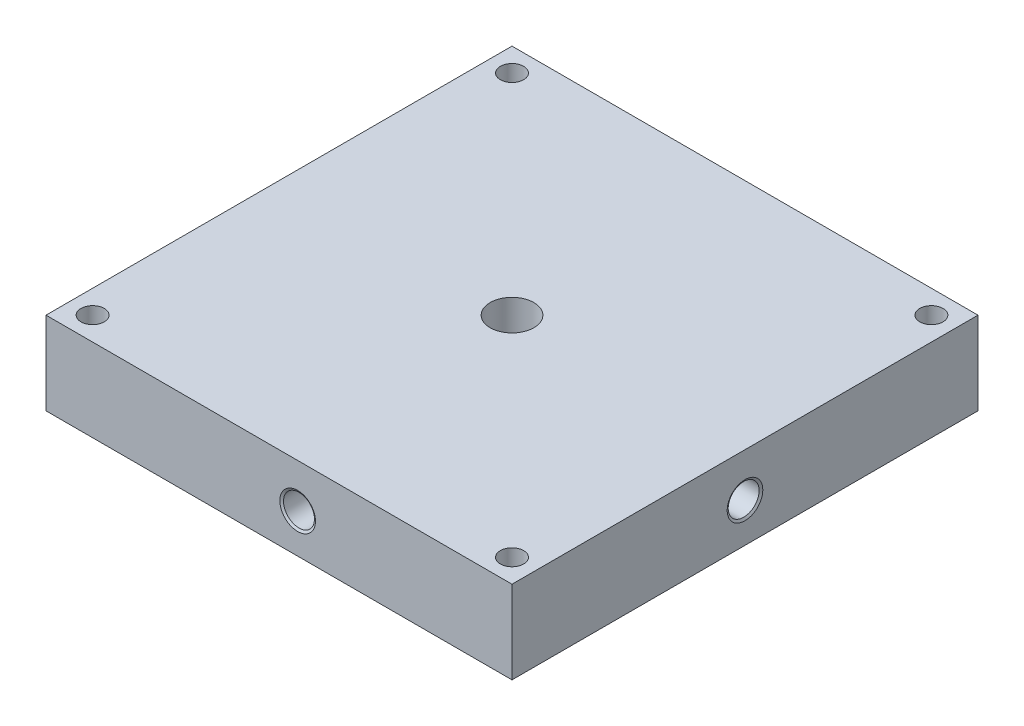
from build123d import *

# Parameters (mm, degrees)
SKETCH5_W                = 127
SKETCH5_H                = 127
SKETCH5_R                = 38.1
SKETCH5_R_2              = 3.175
BOSS_EXTRUDE2_DEPTH      = 17.50822
CUT_EXTRUDE5_REACH       = 145.066
SKETCH8_R                = 3.175
CUT_EXTRUDE9_REACH       = 169.597
SKETCH10_R               = 0.79375
SKETCH11_W               = 127
SKETCH11_H               = 127
SKETCH11_R               = 47.625
BOSS_EXTRUDE3_DEPTH      = 5.08
SKETCH12_R               = 26.9875
SKETCH12_R_2             = 23.8125
CUT_EXTRUDE10_DEPTH      = 2.159
CUT_EXTRUDE12_DEPTH      = 128.262249687
CUT_EXTRUDE12_DEPTH_BACK = 128.262249687
SKETCH14_R               = 3.175
SKETCH15_R               = 19.05
CUT_EXTRUDE13_DEPTH      = 2.032
CIRPATTERN1_COUNT        = 9
CHAMFER1_SIZE            = 0.508


# Read off the part's stored shape, not the designer's step: Q (0.332) Diameter Hole1
with BuildPart() as part:
    # Sketch1 → Revolve1 (revolve)
    with BuildSketch(Plane.XY, mode=Mode.PRIVATE) as revolve1_sk:
        with BuildLine():
            Line((-38.49624, 17.50822), (0, 17.50822))
            Line((0, 17.50822), (0, 0))
            Line((0, 0), (-33.4645, 0))
            Line((-33.4645, 0), (-33.4645, 3.456354569))
            ThreePointArc((-33.4645, 3.456354569), (-33.872854569, 4.980354569), (-34.9885, 6.096))
            Line((-34.9885, 6.096), (-38.49624, 8.96874))
            Line((-38.49624, 8.96874), (-38.49624, 17.50822))
        make_face()
    revolve(revolve1_sk.sketch.rotate(Axis((-44.45, 101.60464546, 0), (0, 1, 0)), 90), axis=Axis((-44.45, 101.60464546, 0), (0, 1, 0)))

    # Sketch5 → Boss-Extrude2 (add)
    with BuildSketch(Plane.XZ):
        with Locations((-44.45, 0)):
            Rectangle(SKETCH5_W, SKETCH5_H)
        with Locations((-44.45, 0)):
            Circle(SKETCH5_R, mode=Mode.SUBTRACT)
        with Locations(Location((-101.6, 57.15, 0), (0, 0, 270))):
            Circle(SKETCH5_R_2, mode=Mode.SUBTRACT)
        with Locations(Location((12.7, 57.15, 0), (0, 0, 90))):
            Circle(SKETCH5_R_2, mode=Mode.SUBTRACT)
        with Locations(Location((12.7, -57.15, 0), (0, 0, 270))):
            Circle(SKETCH5_R_2, mode=Mode.SUBTRACT)
        with Locations(Location((-101.6, -57.15, 0), (0, 0, 90))):
            Circle(SKETCH5_R_2, mode=Mode.SUBTRACT)
    extrude(amount=-BOSS_EXTRUDE2_DEPTH)

    # Sketch8 → Cut-Extrude5 (cut, up to next)
    with BuildSketch(Plane(origin=(19.05, 0, 0), x_dir=(0, 0, -1), z_dir=(1, 0, 0)), mode=Mode.PRIVATE) as cut_extrude5_sk1:
        with Locations((0, 5.588)):
            Circle(SKETCH8_R)
    cut_extrude5_tool1 = extrude(cut_extrude5_sk1.sketch, amount=-CUT_EXTRUDE5_REACH, mode=Mode.PRIVATE) & part.part
    add(cut_extrude5_tool1.solids().sort_by_distance((19.05, 5.588, 0))[0], mode=Mode.SUBTRACT)

    # Sketch10 → Cut-Extrude9 (cut, up to next)
    with BuildSketch(Plane.XY.offset(63.5), mode=Mode.PRIVATE) as cut_extrude9_sk1:
        with Locations((-39.37, 5.588)):
            Circle(SKETCH10_R)
    cut_extrude9_tool1 = extrude(cut_extrude9_sk1.sketch, amount=-CUT_EXTRUDE9_REACH, mode=Mode.PRIVATE) & part.part
    add(cut_extrude9_tool1.solids().sort_by_distance((-39.37, 5.588, 63.5))[0], mode=Mode.SUBTRACT)

    # Sketch11 → Boss-Extrude3 (add)
    with BuildSketch(Plane.XZ):
        with Locations((-44.45, 0)):
            Rectangle(SKETCH11_W, SKETCH11_H)
        with Locations(Location((-44.45, 0, 0), (0, 0, 270))):
            Circle(SKETCH11_R, mode=Mode.SUBTRACT)
    extrude(amount=BOSS_EXTRUDE3_DEPTH)

    # Sketch12 → Cut-Extrude10 (cut)
    with BuildSketch(Plane.XZ):
        with Locations(Location((-44.45, 0, 0), (0, 0, 270))):
            Circle(SKETCH12_R)
        with Locations(Location((-44.45, 0, 0), (0, 0, 270))):
            Circle(SKETCH12_R_2, mode=Mode.SUBTRACT)
    extrude(amount=-CUT_EXTRUDE10_DEPTH, mode=Mode.SUBTRACT)

    # Sketch14 → Cut-Extrude12 (cut, two sides: drawn at the far end of the back side and taken through both)
    with BuildSketch(Plane(origin=(0, 17.50822, 0), x_dir=(1, 0, 0), z_dir=(0, 1, 0)).offset(-CUT_EXTRUDE12_DEPTH_BACK)):
        with Locations(Location((-101.6, 57.15, 0), (0, 0, 270))):
            Circle(SKETCH14_R)
        with Locations(Location((12.7, 57.15, 0), (0, 0, 270))):
            Circle(SKETCH14_R)
        with Locations(Location((12.7, -57.15, 0), (0, 0, 270))):
            Circle(SKETCH14_R)
        with Locations(Location((-101.6, -57.15, 0), (0, 0, 270))):
            Circle(SKETCH14_R)
    extrude(amount=CUT_EXTRUDE12_DEPTH + CUT_EXTRUDE12_DEPTH_BACK, mode=Mode.SUBTRACT)

    # Sketch15 → Cut-Extrude13 (cut)
    with BuildSketch(Plane.XZ):
        with Locations(Location((-44.45, 0, 0), (0, 0, 270))):
            Circle(SKETCH15_R)
    extrude(amount=-CUT_EXTRUDE13_DEPTH, mode=Mode.SUBTRACT)

    # Sketch19 → Tapped Hole for 1/4-20 Helicoil2 (revolve, cut)
    with BuildSketch(Plane(origin=(-79.375, 0, 0), x_dir=(0, 0, -1), z_dir=(1, 0, 0))):
        Polygon((0, 0), (0, 13.459827343), (3.3782, 11.43), (3.3782, 0), align=None)
    tapped_hole_for_1_4_20_helicoil2 = revolve(axis=Axis((-79.375, -6.35, 0), (0, 1, 0)), mode=Mode.SUBTRACT)

    # CirPattern1: Tapped Hole for 1/4-20 Helicoil2 ×9 about axis
    cirpattern1_axis = Axis((-44.45, 0, 0), (0, 1, 0))
    for i in range(1, CIRPATTERN1_COUNT):
        add(tapped_hole_for_1_4_20_helicoil2.rotate(cirpattern1_axis, i * 360 / CIRPATTERN1_COUNT), mode=Mode.SUBTRACT)

    # Chamfer1
    chamfer1_edges = [part.edges().sort_by_distance(p)[0] for p in [
        (-44.45, 0, 19.05),
    ]]
    chamfer(chamfer1_edges, length=CHAMFER1_SIZE)

    # Q (0.332) Diameter Hole1 outline → Q (0.332) Diameter Hole1 (revolve, cut)
    with BuildSketch(Plane(origin=(-39.37, 5.588, 0), x_dir=(1, 0, 0), z_dir=(0, -1, 0))):
        Polygon((0.79375, 63.5), (0.79375, 53.315464402), (4.2164, 55.372), (4.2164, 63.133382579), (4.8514, 63.5), align=None)
    revolve(axis=Axis((-39.37, 5.588, 0), (0, 0, 1)), mode=Mode.SUBTRACT)

    # Q _0.332_ Diameter Hole1 2 outline → Q _0.332_ Diameter Hole1 2 (revolve, cut)
    with BuildSketch(Plane(origin=(0, 5.588, 0), x_dir=(0, 1, 0), z_dir=(0, 0, -1))):
        Polygon((3.175, 19.05), (3.175, 10.296263751), (4.2164, 10.922), (4.2164, 18.683382579), (4.8514, 19.05), align=None)
    revolve(axis=Axis((0, 5.588, 0), (1, 0, 0)), mode=Mode.SUBTRACT)


solid = part.part
